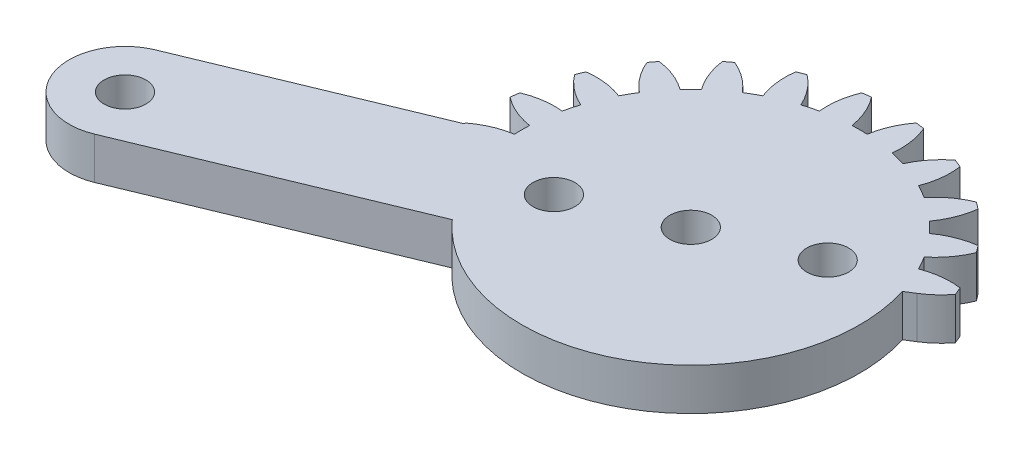
from build123d import *

# Parameters (mm, degrees)
SKETCH1_R              = 1.5
BOSS_EXTRUDE1_DEPTH    = 3
SKETCH3_R              = 1.5
BOSS_EXTRUDE2_DEPTH    = 3
CUT_EXTRUDE1_OUTLINE_R = 1.5
CUT_EXTRUDE1_DEPTH     = 3


# Read off the part's stored shape, not the designer's step: Cut-Extrude1
with BuildPart() as part:
    # Sketch1 → Boss-Extrude1 (new body)
    with BuildSketch(Plane(origin=(0, 0, 0), x_dir=(1, 0, 0), z_dir=(0, 1, 0))):
        with BuildLine():
            Line((20.643657446, 4), (2.081641936, 4))
            ThreePointArc((2.081641936, 4), (2.861028333, 4.588201733), (3.521749436, 5.30713988))
            ThreePointArc((3.521749436, 5.30713988), (3.405395609, 5.596745198), (3.282888305, 5.883801663))
            ThreePointArc((3.282888305, 5.883801663), (1.93527598, 5.894040025), (0.627094961, 5.57027124))
            ThreePointArc((0.627094961, 5.57027124), (0.366286148, 6.046375), (0.084372603, 6.510293938))
            ThreePointArc((0.084372603, 6.510293938), (1.018855105, 7.48132754), (1.683794586, 8.65351323))
            ThreePointArc((1.683794586, 8.65351323), (1.496450048, 8.903135899), (1.303821399, 9.148703928))
            ThreePointArc((1.303821399, 9.148703928), (-0.000522033, 8.809805691), (-1.180330337, 8.158486898))
            ThreePointArc((-1.180330337, 8.158486898), (-1.555477026, 8.550865528), (-1.947855656, 8.926012217))
            ThreePointArc((-1.947855656, 8.926012217), (-1.296536862, 10.105820521), (-0.957638625, 11.410163953))
            ThreePointArc((-0.957638625, 11.410163953), (-1.203206655, 11.602792602), (-1.452829324, 11.79013714))
            ThreePointArc((-1.452829324, 11.79013714), (-2.625015014, 11.125197659), (-3.596048616, 10.190715157))
            ThreePointArc((-3.596048616, 10.190715157), (-4.059967554, 10.472628702), (-4.536071314, 10.733437515))
            ThreePointArc((-4.536071314, 10.733437515), (-4.212302529, 12.041618533), (-4.222540891, 13.389230859))
            ThreePointArc((-4.222540891, 13.389230859), (-4.509597355, 13.511738163), (-4.799202674, 13.62809199))
            ThreePointArc((-4.799202674, 13.62809199), (-5.759348103, 12.682425791), (-6.455432668, 11.528463019))
            ThreePointArc((-6.455432668, 11.528463019), (-6.976508546, 11.680699536), (-7.503891752, 11.809396783))
            ThreePointArc((-7.503891752, 11.809396783), (-7.529737283, 13.156800143), (-7.888414517, 14.455843809))
            ThreePointArc((-7.888414517, 14.455843809), (-8.197396993, 14.499881098), (-8.507248835, 14.537314892))
            ThreePointArc((-8.507248835, 14.537314892), (-9.18992168, 13.375367565), (-9.563620196, 12.080565177))
            ThreePointArc((-9.563620196, 12.080565177), (-10.106342554, 12.09275), (-10.649064912, 12.080565177))
            ThreePointArc((-10.649064912, 12.080565177), (-11.022763428, 13.375367565), (-11.705436272, 14.537314892))
            ThreePointArc((-11.705436272, 14.537314892), (-12.015288115, 14.499881098), (-12.324270591, 14.455843809))
            ThreePointArc((-12.324270591, 14.455843809), (-12.682947825, 13.156800143), (-12.708793355, 11.809396783))
            ThreePointArc((-12.708793355, 11.809396783), (-13.236176561, 11.680699536), (-13.757252439, 11.528463019))
            ThreePointArc((-13.757252439, 11.528463019), (-14.453337005, 12.682425791), (-15.413482434, 13.62809199))
            ThreePointArc((-15.413482434, 13.62809199), (-15.703087752, 13.511738163), (-15.990144217, 13.389230859))
            ThreePointArc((-15.990144217, 13.389230859), (-16.000382579, 12.041618533), (-15.676613793, 10.733437515))
            ThreePointArc((-15.676613793, 10.733437515), (-16.152717554, 10.472628702), (-16.616636492, 10.190715157))
            ThreePointArc((-16.616636492, 10.190715157), (-17.587670094, 11.125197659), (-18.759855783, 11.79013714))
            ThreePointArc((-18.759855783, 11.79013714), (-19.009478453, 11.602792602), (-19.255046482, 11.410163953))
            ThreePointArc((-19.255046482, 11.410163953), (-18.916148245, 10.105820521), (-18.264829452, 8.926012217))
            ThreePointArc((-18.264829452, 8.926012217), (-18.657208082, 8.550865528), (-19.032354771, 8.158486898))
            ThreePointArc((-19.032354771, 8.158486898), (-20.212163074, 8.809805691), (-21.516506507, 9.148703928))
            ThreePointArc((-21.516506507, 9.148703928), (-21.709135156, 8.903135899), (-21.896479694, 8.65351323))
            ThreePointArc((-21.896479694, 8.65351323), (-21.231540213, 7.48132754), (-20.297057711, 6.510293938))
            ThreePointArc((-20.297057711, 6.510293938), (-20.578971255, 6.046375), (-20.839780068, 5.57027124))
            ThreePointArc((-20.839780068, 5.57027124), (-22.147961087, 5.894040025), (-23.495573413, 5.883801663))
            ThreePointArc((-23.495573413, 5.883801663), (-23.618080717, 5.596745198), (-23.734434544, 5.30713988))
            ThreePointArc((-23.734434544, 5.30713988), (-22.788768345, 4.346994451), (-21.634805572, 3.650909885))
            ThreePointArc((-21.634805572, 3.650909885), (-21.78704209, 3.129834008), (-21.915739337, 2.602450802))
            ThreePointArc((-21.915739337, 2.602450802), (-23.263142697, 2.576605271), (-24.562186363, 2.217928037))
            ThreePointArc((-24.562186363, 2.217928037), (-24.606223651, 1.908945561), (-24.643657446, 1.599093719))
            ThreePointArc((-24.643657446, 1.599093719), (-23.481710119, 0.916420874), (-22.186907731, 0.542722358))
            ThreePointArc((-22.186907731, 0.542722358), (-22.199092554, 0), (-22.186907731, -0.542722358))
            ThreePointArc((-22.186907731, -0.542722358), (-23.481710119, -0.916420874), (-24.643657446, -1.599093719))
            ThreePointArc((-24.643657446, -1.599093719), (-24.606223651, -1.908945561), (-24.562186363, -2.217928037))
            ThreePointArc((-24.562186363, -2.217928037), (-23.263142697, -2.576605271), (-21.915739337, -2.602450802))
            ThreePointArc((-21.915739337, -2.602450802), (-21.78704209, -3.129834008), (-21.634805572, -3.650909885))
            ThreePointArc((-21.634805572, -3.650909885), (-22.788768345, -4.346994451), (-23.734434544, -5.30713988))
            ThreePointArc((-23.734434544, -5.30713988), (-23.618080717, -5.596745198), (-23.495573413, -5.883801663))
            ThreePointArc((-23.495573413, -5.883801663), (-22.147961087, -5.894040025), (-20.839780068, -5.57027124))
            ThreePointArc((-20.839780068, -5.57027124), (-20.578971255, -6.046375), (-20.297057711, -6.510293938))
            ThreePointArc((-20.297057711, -6.510293938), (-21.231540213, -7.48132754), (-21.896479694, -8.65351323))
            ThreePointArc((-21.896479694, -8.65351323), (-21.709135156, -8.903135899), (-21.516506507, -9.148703928))
            ThreePointArc((-21.516506507, -9.148703928), (-20.212163074, -8.809805691), (-19.032354771, -8.158486898))
            ThreePointArc((-19.032354771, -8.158486898), (-18.657208082, -8.550865528), (-18.264829452, -8.926012217))
            ThreePointArc((-18.264829452, -8.926012217), (-18.916148245, -10.105820521), (-19.255046482, -11.410163953))
            ThreePointArc((-19.255046482, -11.410163953), (-19.009478453, -11.602792602), (-18.759855783, -11.79013714))
            ThreePointArc((-18.759855783, -11.79013714), (-17.587670094, -11.125197659), (-16.616636492, -10.190715157))
            ThreePointArc((-16.616636492, -10.190715157), (-16.152717554, -10.472628702), (-15.676613793, -10.733437515))
            ThreePointArc((-15.676613793, -10.733437515), (-16.000382579, -12.041618533), (-15.990144217, -13.389230859))
            ThreePointArc((-15.990144217, -13.389230859), (-15.703087752, -13.511738163), (-15.413482434, -13.62809199))
            ThreePointArc((-15.413482434, -13.62809199), (-14.453337005, -12.682425791), (-13.757252439, -11.528463019))
            ThreePointArc((-13.757252439, -11.528463019), (-13.236176561, -11.680699536), (-12.708793355, -11.809396783))
            ThreePointArc((-12.708793355, -11.809396783), (-12.682947825, -13.156800143), (-12.324270591, -14.455843809))
            ThreePointArc((-12.324270591, -14.455843809), (-12.015288115, -14.499881098), (-11.705436272, -14.537314892))
            ThreePointArc((-11.705436272, -14.537314892), (-11.022763428, -13.375367565), (-10.649064912, -12.080565177))
            ThreePointArc((-10.649064912, -12.080565177), (-10.106342554, -12.09275), (-9.563620196, -12.080565177))
            ThreePointArc((-9.563620196, -12.080565177), (-9.18992168, -13.375367565), (-8.507248835, -14.537314892))
            ThreePointArc((-8.507248835, -14.537314892), (-8.197396993, -14.499881098), (-7.888414517, -14.455843809))
            ThreePointArc((-7.888414517, -14.455843809), (-7.529737283, -13.156800143), (-7.503891752, -11.809396783))
            ThreePointArc((-7.503891752, -11.809396783), (-6.976508546, -11.680699536), (-6.455432668, -11.528463019))
            ThreePointArc((-6.455432668, -11.528463019), (-5.759348103, -12.682425791), (-4.799202674, -13.62809199))
            ThreePointArc((-4.799202674, -13.62809199), (-4.509597355, -13.511738163), (-4.222540891, -13.389230859))
            ThreePointArc((-4.222540891, -13.389230859), (-4.212302529, -12.041618533), (-4.536071314, -10.733437515))
            ThreePointArc((-4.536071314, -10.733437515), (-4.059967554, -10.472628702), (-3.596048616, -10.190715157))
            ThreePointArc((-3.596048616, -10.190715157), (-2.625015014, -11.125197659), (-1.452829324, -11.79013714))
            ThreePointArc((-1.452829324, -11.79013714), (-1.203206655, -11.602792602), (-0.957638625, -11.410163953))
            ThreePointArc((-0.957638625, -11.410163953), (-1.296536862, -10.105820521), (-1.947855656, -8.926012217))
            ThreePointArc((-1.947855656, -8.926012217), (-1.555477026, -8.550865528), (-1.180330337, -8.158486898))
            ThreePointArc((-1.180330337, -8.158486898), (-0.000522033, -8.809805691), (1.303821399, -9.148703928))
            ThreePointArc((1.303821399, -9.148703928), (1.496450048, -8.903135899), (1.683794586, -8.65351323))
            ThreePointArc((1.683794586, -8.65351323), (1.018855105, -7.48132754), (0.084372603, -6.510293938))
            ThreePointArc((0.084372603, -6.510293938), (0.366286148, -6.046375), (0.627094961, -5.57027124))
            ThreePointArc((0.627094961, -5.57027124), (1.93527598, -5.894040025), (3.282888305, -5.883801663))
            ThreePointArc((3.282888305, -5.883801663), (3.405395609, -5.596745198), (3.521749436, -5.30713988))
            ThreePointArc((3.521749436, -5.30713988), (2.861028333, -4.588201733), (2.081641936, -4))
            Line((2.081641936, -4), (20.643657446, -4))
            ThreePointArc((20.643657446, -4), (24.643657446, 0), (20.643657446, 4))
        make_face()
        with Locations(Location((-10.106342554, 0, 0), (0, 0, 270))):
            Circle(SKETCH1_R, mode=Mode.SUBTRACT)
        with Locations(Location((20.643657446, 0, 0), (0, 0, 270))):
            Circle(SKETCH1_R, mode=Mode.SUBTRACT)
    extrude(amount=BOSS_EXTRUDE1_DEPTH)

    # Sketch3 → Boss-Extrude2 (add)
    with BuildSketch(Plane(origin=(0, 3, 0), x_dir=(1, 0, 0), z_dir=(0, 1, 0))):
        with BuildLine():
            Line((-14.106342554, 0), (-20.558846273, 0))
            Line((-20.558846273, 0), (-40.277341791, -8.167668273))
            ThreePointArc((-40.277341791, -8.167668273), (-42.442126192, -13.393920133), (-37.215874332, -15.558704533))
            Line((-37.215874332, -15.558704533), (-8.575608824, -3.69551813))
            ThreePointArc((-8.575608824, -3.69551813), (-12.328623486, -3.325878449), (-14.106342554, 0))
        make_face()
        with Locations(Location((-38.746608062, -11.863186403, 0), (0, 0, 270))):
            Circle(SKETCH3_R, mode=Mode.SUBTRACT)
    extrude(amount=-BOSS_EXTRUDE2_DEPTH)

    # Cut-Extrude1 outline → Cut-Extrude1 (cut)
    # profile 1 of 11: a face of its own
    with BuildSketch(Plane(origin=(0, 0, 0), x_dir=(1, 0, 0), z_dir=(0, 1, 0))):
        with BuildLine():
            Line((2.081641936, 4), (1.43808022, 3.600125745))
            ThreePointArc((1.43808022, 3.600125745), (1.939395695, -1.065266441), (0.627094961, -5.57027124))
            ThreePointArc((0.627094961, -5.57027124), (1.93527598, -5.894040025), (3.282888305, -5.883801663))
            ThreePointArc((3.282888305, -5.883801663), (3.405395609, -5.596745198), (3.521749436, -5.30713988))
            ThreePointArc((3.521749436, -5.30713988), (2.861028333, -4.588201733), (2.081641936, -4))
            Line((2.081641936, -4), (20.643657446, -4))
            ThreePointArc((20.643657446, -4), (24.643657446, 0), (20.643657446, 4))
            Line((20.643657446, 4), (2.081641936, 4))
        make_face()
        with Locations((20.643657446, 0)):
            Circle(CUT_EXTRUDE1_OUTLINE_R, mode=Mode.SUBTRACT)
    # profile 2 of 11: a face of its own
    with BuildSketch(Plane(origin=(0, 0, 0), x_dir=(1, 0, 0), z_dir=(0, 1, 0))):
        with BuildLine():
            ThreePointArc((-21.516506507, -9.148703928), (-20.212163075, -8.809805691), (-19.032354771, -8.158486898))
            ThreePointArc((-19.032354771, -8.158486898), (-19.075783612, -8.110716964), (-19.118956803, -8.062715855))
            Line((-19.118956803, -8.062715855), (-21.572155055, -9.078863843))
            ThreePointArc((-21.572155055, -9.078863843), (-21.544384086, -9.113826359), (-21.516506507, -9.148703928))
        make_face()
    # profile 3 of 11: a face of its own
    with BuildSketch(Plane(origin=(0, 0, 0), x_dir=(1, 0, 0), z_dir=(0, 1, 0))):
        with BuildLine():
            ThreePointArc((-18.759855783, -11.79013714), (-17.587670094, -11.125197659), (-16.616636492, -10.190715157))
            ThreePointArc((-16.616636492, -10.190715157), (-17.467942325, -9.593823606), (-18.264829452, -8.926012217))
            ThreePointArc((-18.264829452, -8.926012217), (-18.916148245, -10.105820521), (-19.255046482, -11.410163953))
            ThreePointArc((-19.255046482, -11.410163953), (-19.009478453, -11.602792602), (-18.759855783, -11.79013714))
        make_face()
    # profile 4 of 11: a face of its own
    with BuildSketch(Plane(origin=(0, 0, 0), x_dir=(1, 0, 0), z_dir=(0, 1, 0))):
        with BuildLine():
            ThreePointArc((-15.413482434, -13.62809199), (-14.453337005, -12.682425791), (-13.757252439, -11.528463019))
            ThreePointArc((-13.757252439, -11.528463019), (-14.73403763, -11.172244217), (-15.676613793, -10.733437515))
            ThreePointArc((-15.676613793, -10.733437515), (-16.000382579, -12.041618533), (-15.990144217, -13.389230859))
            ThreePointArc((-15.990144217, -13.389230859), (-15.703087752, -13.511738163), (-15.413482434, -13.62809199))
        make_face()
    # profile 5 of 11: a face of its own
    with BuildSketch(Plane(origin=(0, 0, 0), x_dir=(1, 0, 0), z_dir=(0, 1, 0))):
        with BuildLine():
            ThreePointArc((-11.705436272, -14.537314892), (-11.022763428, -13.375367565), (-10.649064912, -12.080565177))
            ThreePointArc((-10.649064912, -12.080565177), (-11.684763165, -11.989294847), (-12.708793355, -11.809396783))
            ThreePointArc((-12.708793355, -11.809396783), (-12.682947825, -13.156800143), (-12.324270591, -14.455843809))
            ThreePointArc((-12.324270591, -14.455843809), (-12.015288115, -14.499881098), (-11.705436272, -14.537314892))
        make_face()
    # profile 6 of 11: a face of its own
    with BuildSketch(Plane(origin=(0, 0, 0), x_dir=(1, 0, 0), z_dir=(0, 1, 0))):
        with BuildLine():
            ThreePointArc((-7.888414517, -14.455843809), (-7.529737283, -13.156800143), (-7.503891752, -11.809396783))
            ThreePointArc((-7.503891752, -11.809396783), (-8.527921943, -11.989294847), (-9.563620196, -12.080565177))
            ThreePointArc((-9.563620196, -12.080565177), (-9.18992168, -13.375367565), (-8.507248835, -14.537314892))
            ThreePointArc((-8.507248835, -14.537314892), (-8.197396993, -14.499881098), (-7.888414517, -14.455843809))
        make_face()
    # profile 7 of 11: a face of its own
    with BuildSketch(Plane(origin=(0, 0, 0), x_dir=(1, 0, 0), z_dir=(0, 1, 0))):
        with BuildLine():
            ThreePointArc((-4.222540891, -13.389230859), (-4.212302529, -12.041618534), (-4.536071314, -10.733437515))
            ThreePointArc((-4.536071314, -10.733437515), (-5.478647477, -11.172244217), (-6.455432668, -11.528463019))
            ThreePointArc((-6.455432668, -11.528463019), (-5.759348103, -12.682425792), (-4.799202674, -13.62809199))
            ThreePointArc((-4.799202674, -13.62809199), (-4.509597356, -13.511738163), (-4.222540891, -13.389230859))
        make_face()
    # profile 8 of 11: a face of its own
    with BuildSketch(Plane(origin=(0, 0, 0), x_dir=(1, 0, 0), z_dir=(0, 1, 0))):
        with BuildLine():
            ThreePointArc((-0.957638625, -11.410163953), (-1.296536862, -10.105820521), (-1.947855656, -8.926012217))
            ThreePointArc((-1.947855656, -8.926012217), (-2.744742783, -9.593823606), (-3.596048616, -10.190715157))
            ThreePointArc((-3.596048616, -10.190715157), (-2.625015014, -11.125197659), (-1.452829324, -11.79013714))
            ThreePointArc((-1.452829324, -11.79013714), (-1.203206654, -11.602792602), (-0.957638625, -11.410163953))
        make_face()
    # profile 9 of 11: a face of its own
    with BuildSketch(Plane(origin=(0, 0, 0), x_dir=(1, 0, 0), z_dir=(0, 1, 0))):
        with BuildLine():
            ThreePointArc((1.683794586, -8.65351323), (1.018855105, -7.48132754), (0.084372603, -6.510293938))
            ThreePointArc((0.084372603, -6.510293938), (-0.512518948, -7.361599771), (-1.180330337, -8.158486898))
            ThreePointArc((-1.180330337, -8.158486898), (-0.000522033, -8.809805691), (1.303821399, -9.148703928))
            ThreePointArc((1.303821399, -9.148703928), (1.496450048, -8.903135899), (1.683794586, -8.65351323))
        make_face()
    # profile 10 of 11: a face of its own
    with BuildSketch(Plane(origin=(0, 0, 0), x_dir=(1, 0, 0), z_dir=(0, 1, 0))):
        with Locations((-17.035439048, -2.870125743)):
            Circle(CUT_EXTRUDE1_OUTLINE_R)
    # profile 11 of 11: a face of its own
    with BuildSketch(Plane(origin=(0, 0, 0), x_dir=(1, 0, 0), z_dir=(0, 1, 0))):
        with Locations((-3.17724606, 2.870125743)):
            Circle(CUT_EXTRUDE1_OUTLINE_R)
    extrude(amount=CUT_EXTRUDE1_DEPTH, mode=Mode.SUBTRACT)


solid = part.part
